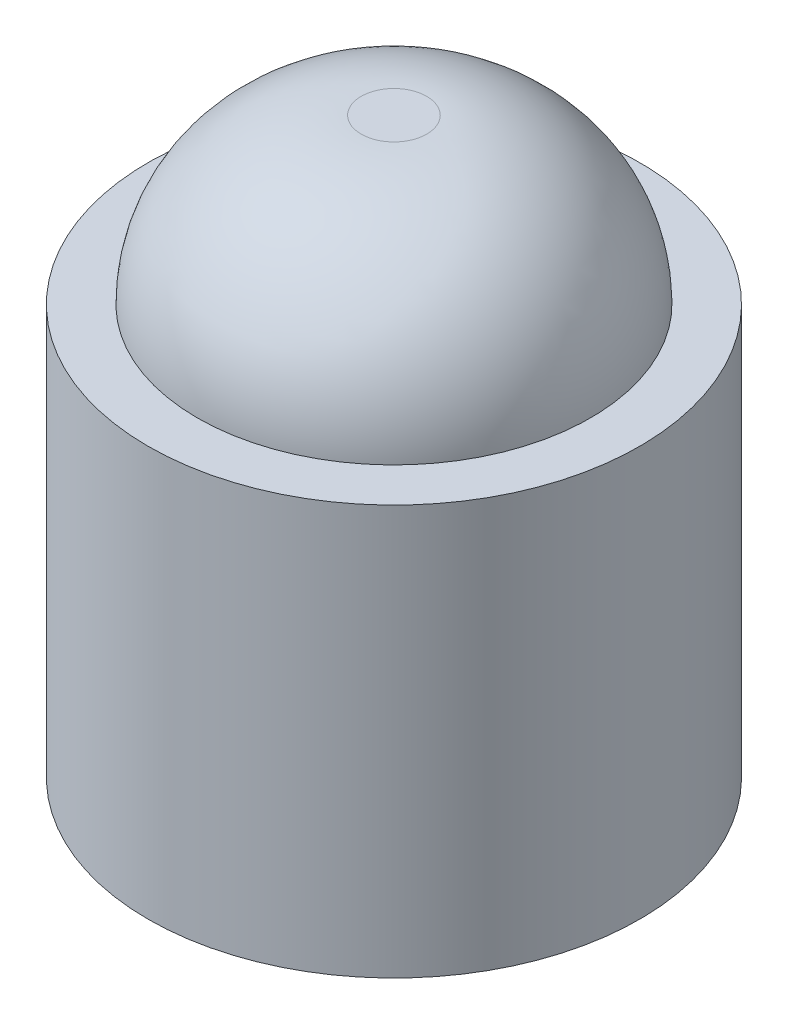
from build123d import *

# Parameters (mm, degrees)
SKETCH1_R           = 15
BOSS_EXTRUDE1_DEPTH = 25
SKETCH2_R           = 12
CUT_EXTRUDE1_DEPTH  = 10
BOSS_EXTRUDE2_START = 20
SKETCH3_R           = 12
BOSS_EXTRUDE2_DEPTH = 20
FILLET1_R           = 10


with BuildPart() as part:
    # Sketch1 → Boss-Extrude1 (new body)
    with BuildSketch(Plane(origin=(0, 0, 0), x_dir=(1, 0, 0), z_dir=(0, 1, 0))):
        with Locations(Location((0, 0, 0), (0, 0, 270))):
            Circle(SKETCH1_R)
    extrude(amount=BOSS_EXTRUDE1_DEPTH)

    # Sketch2 → Cut-Extrude1 (cut)
    with BuildSketch(Plane(origin=(0, 25, 0), x_dir=(1, 0, 0), z_dir=(0, 1, 0))):
        with Locations(Location((0, 0, 0), (0, 0, 270))):
            Circle(SKETCH2_R)
    extrude(amount=-CUT_EXTRUDE1_DEPTH, mode=Mode.SUBTRACT)

    # Sketch3 → Boss-Extrude2 (add)
    with BuildSketch(Plane(origin=(0, 15, 0), x_dir=(1, 0, 0), z_dir=(0, 1, 0)).offset(BOSS_EXTRUDE2_START)):
        with Locations(Location((0, 0, 0), (0, 0, 270))):
            Circle(SKETCH3_R)
    extrude(amount=-BOSS_EXTRUDE2_DEPTH)

    # Fillet1
    fillet1_edges = [part.edges().sort_by_distance(p)[0] for p in [
        (0, 35, -12),
    ]]
    fillet(fillet1_edges, radius=FILLET1_R - 0.0001)  # a hair under: the kernel refuses the full size


solid = part.part
